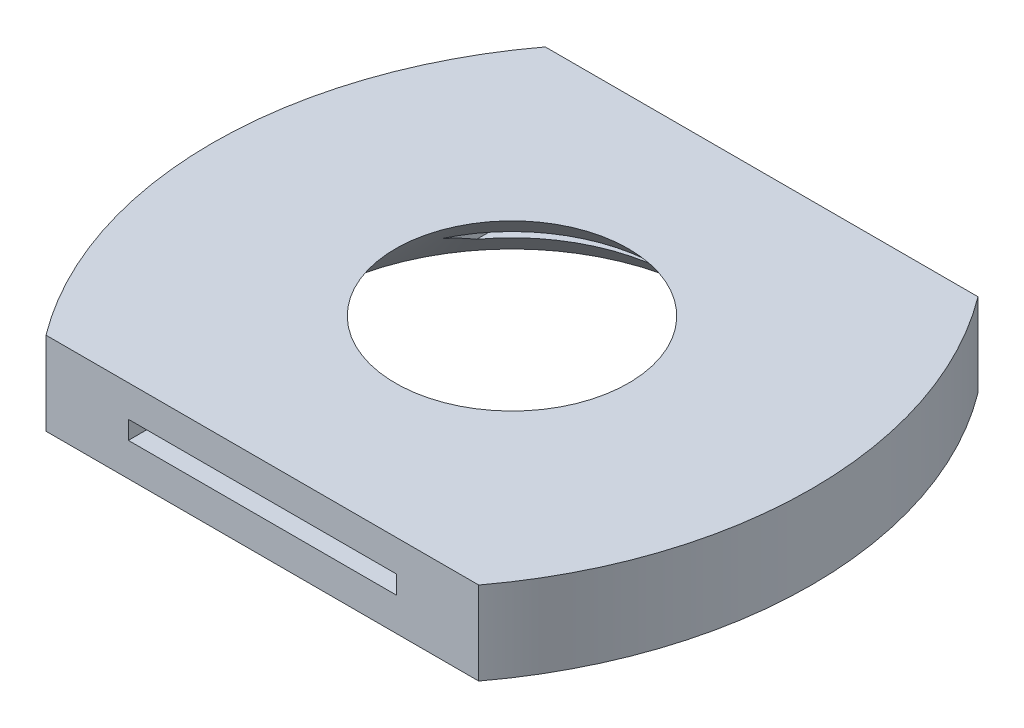
from build123d import *

# Parameters (mm, degrees)
BOSS_EXTRUDE1_DEPTH  = 50
CARBON_FILTER_HOLE_W = 161
CARBON_FILTER_HOLE_H = 11
CUT_EXTRUDE3_DEPTH   = 280
SKETCH1_R            = 3
CUT_EXTRUDE4_DEPTH   = 20


with BuildPart() as part:
    # Lid case → Boss-Extrude1 (new body)
    with BuildSketch(Plane(origin=(0, 0, 0), x_dir=(1, 0, 0), z_dir=(0, 1, 0))):
        with BuildLine():
            Line((-130, 150), (130, 150))
            ThreePointArc((130, 150), (180, 0), (130, -150))
            Line((130, -150), (-130, -150))
            ThreePointArc((-130, -150), (-180, 0), (-130, 150))
        make_face()
    extrude(amount=BOSS_EXTRUDE1_DEPTH)

    # Ventilation → Cut-Revolve1 (revolve, cut)
    with BuildSketch(Plane.XY):
        Polygon((0, 50), (0, 0), (-120, 0), (-70, 50), align=None)
    revolve(axis=Axis((0, -54.373231572, 0), (0, 1, 0)), mode=Mode.SUBTRACT)

    # Carbon filter hole → Cut-Extrude3 (cut)
    with BuildSketch(Plane.XY.offset(150)):
        with Locations((0, 25.5)):
            Rectangle(CARBON_FILTER_HOLE_W, CARBON_FILTER_HOLE_H)
    extrude(amount=-CUT_EXTRUDE3_DEPTH, mode=Mode.SUBTRACT)

    # Sketch1 → Cut-Extrude4 (cut)
    with BuildSketch(Plane.XZ):
        with Locations((-110, -139)):
            Circle(SKETCH1_R)
        with Locations((-82, -139)):
            Circle(SKETCH1_R)
        with Locations((-54, -139)):
            Circle(SKETCH1_R)
        with Locations((54, -139)):
            Circle(SKETCH1_R)
        with Locations((82, -139)):
            Circle(SKETCH1_R)
        with Locations((110, -139)):
            Circle(SKETCH1_R)
    extrude(amount=-CUT_EXTRUDE4_DEPTH, mode=Mode.SUBTRACT)


solid = part.part
